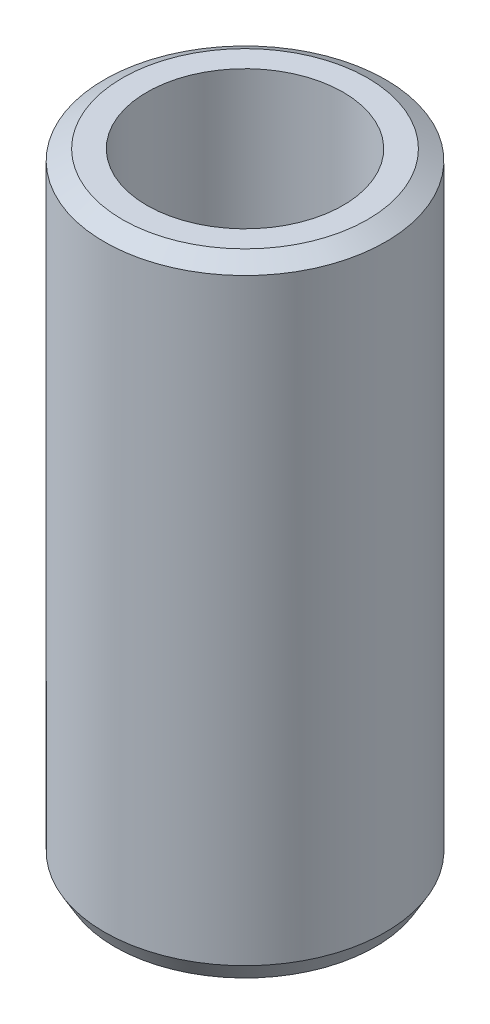
from build123d import *
from OCP.BRepFilletAPI import BRepFilletAPI_MakeChamfer

# Parameters (mm, degrees)
SKETCH1_R           = 55
BOSS_EXTRUDE1_DEPTH = 244.865349336
SKETCH2_R           = 38.368574778
CUT_EXTRUDE1_DEPTH  = 257.922243695
CHAMFER1_SIZE       = 4.060918697
CHAMFER1_SIZE2      = 7.033717509


with BuildPart() as part:
    # Sketch1 → Boss-Extrude1 (new body)
    with BuildSketch(Plane(origin=(0, 0, 0), x_dir=(1, 0, 0), z_dir=(0, 1, 0))):
        Circle(SKETCH1_R)
    extrude(amount=BOSS_EXTRUDE1_DEPTH)

    # Sketch2 → Cut-Extrude1 (cut, through all)
    with BuildSketch(Plane(origin=(0, 0, 0), x_dir=(1, 0, 0), z_dir=(0, 1, 0))):
        Circle(SKETCH2_R)
    extrude(amount=CUT_EXTRUDE1_DEPTH, mode=Mode.SUBTRACT)

    # Chamfer1: one chamfer whose edges measure the first distance from different faces: ONE call of the kernel's chamfer builder (chamfer() names one face for all edges)
    chamfer1_edges_1 = [part.edges().sort_by_distance(p)[0] for p in [
        (-55, 244.865349336, 0),
    ]]
    chamfer1_side_1 = [part.faces().sort_by_distance(p)[0] for p in [
        (-55, 122.432674668, 0),
    ]]
    chamfer1_edges_2 = [part.edges().sort_by_distance(p)[0] for p in [
        (-55, 0, 0),
    ]]
    chamfer1_side_2 = [part.faces().sort_by_distance(p)[0] for p in [
        (-53.444365081, 0, 0),
    ]]
    chamfer1 = BRepFilletAPI_MakeChamfer(part.part.solid().wrapped)
    for e in chamfer1_edges_1:
        chamfer1.Add(CHAMFER1_SIZE, CHAMFER1_SIZE2, e.wrapped, chamfer1_side_1[0].wrapped)  # the first distance lies on this face
    for e in chamfer1_edges_2:
        chamfer1.Add(CHAMFER1_SIZE, CHAMFER1_SIZE2, e.wrapped, chamfer1_side_2[0].wrapped)  # the first distance lies on this face
    add(Compound.cast(chamfer1.Shape()), mode=Mode.REPLACE)


solid = part.part
